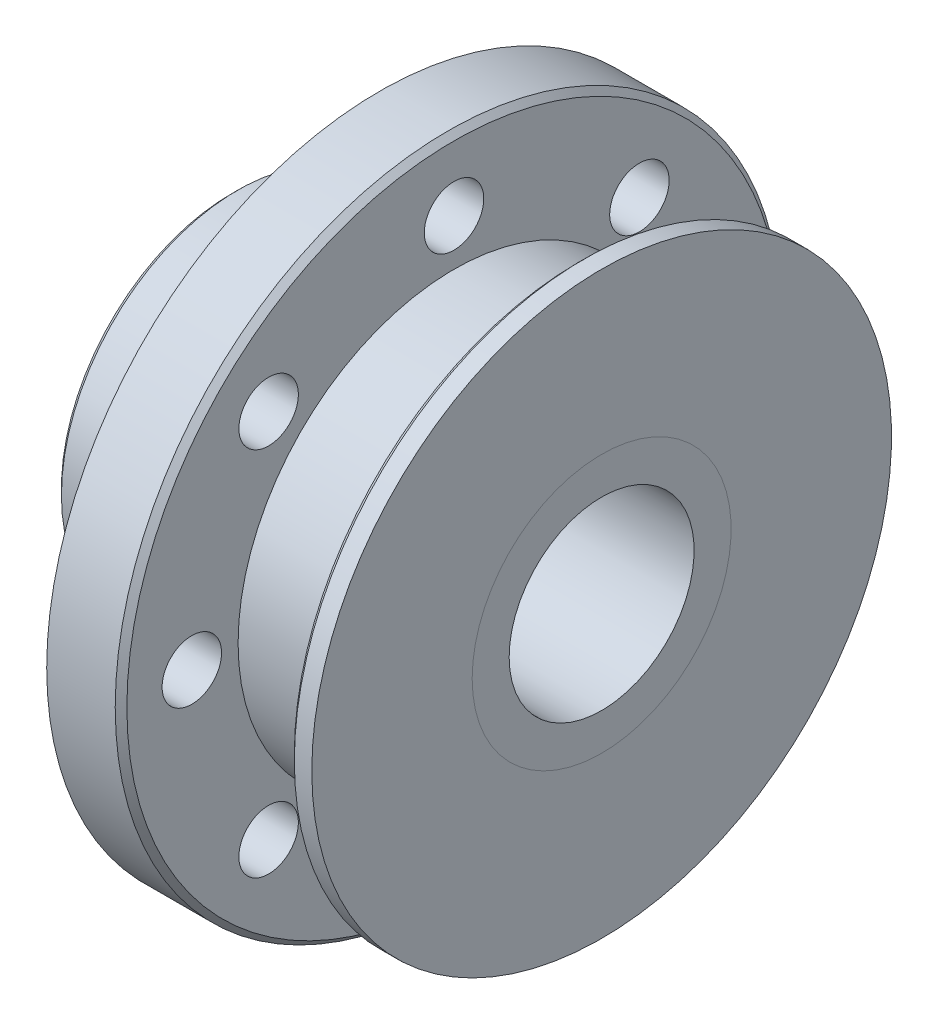
from build123d import *

# Parameters (mm, degrees)
F_1_4_20_TAPPED_HOLE1_D                     = 5.1054
F_1_4_20_TAPPED_HOLE1_DEPTH                 = 10.16
F_1_4_20_TAPPED_HOLE1_TIP                   = 1.533816902
SKETCH5_W                                   = 12.7
SKETCH5_H                                   = 3.175
CHAMFER1_SIZE                               = 0.5
TOL_SO_NEEDLE_ROLLER_SITS_FLUSH_OF_FACE_BY  = 0.1
TOL_SO_NEEDLE_ROLLER_SITS_FLUSH_OF_FACE2_BY = 0.100000054


with BuildPart() as part:
    # Sketch1 → Revolve1 (revolve)
    with BuildSketch(Plane.XY):
        Polygon((-12.7, 15.112500017), (0, 15.112500017), (0, 28.575), (6.37999994, 28.575), (6.37999994, 24.875000034), (6.37999994, 18.52951598), (17.04999994, 18.52951598), (17.04999994, 24.875000034), (19.05, 24.875000034), (19.05, 11.1125), (6.35, 11.1125), (6.35, 8.9375), (0, 8.9375), (0, 11.1125), (-12.7, 11.1125), align=None)
    revolve(axis=Axis((0, 0, 0), (1, 0, 0)))

    # 1/4-20 Tapped Hole1
    with Locations(Plane.ZY):
        with Locations((-15.909902577, -15.909902577), (-22.5, 0), (-15.909902577, 15.909902577), (0, 22.5), (15.909902577, 15.909902577), (22.5, 0), (15.909902577, -15.909902577), (0, -22.5)):
            Hole(F_1_4_20_TAPPED_HOLE1_D / 2, depth=F_1_4_20_TAPPED_HOLE1_DEPTH)
            with Locations((0, 0, -(F_1_4_20_TAPPED_HOLE1_DEPTH + F_1_4_20_TAPPED_HOLE1_TIP / 2))):  # 118° drill point
                Cone(0, F_1_4_20_TAPPED_HOLE1_D / 2, F_1_4_20_TAPPED_HOLE1_TIP, mode=Mode.SUBTRACT)

    # Chamfer1
    chamfer1_edges = [part.edges().sort_by_distance(p)[0] for p in [
        (17.04999994, -24.875000034, 0),
        (6.37999994, -28.575, 0),
        (-12.7, -15.112500017, 0),
    ]]
    chamfer(chamfer1_edges, length=CHAMFER1_SIZE)

    # Tol so Needle Roller sits flush of face: a face moved inward by 0.1
    extrude(part.faces().sort_by_distance((6.35, -5.55625, -8.89))[0], amount=TOL_SO_NEEDLE_ROLLER_SITS_FLUSH_OF_FACE_BY, dir=(-1, 0, 0), mode=Mode.SUBTRACT)

    # Tol so Needle Roller sits flush of face2: a face moved inward by 0.1
    extrude(part.faces().sort_by_distance((0, 5.55625, -8.89))[0], amount=TOL_SO_NEEDLE_ROLLER_SITS_FLUSH_OF_FACE2_BY, dir=(1, 0, 0), mode=Mode.SUBTRACT)


with BuildPart() as body_2:
    # Sketch5 → Revolve2 (revolve)
    with BuildSketch(Plane.XY):
        with Locations((12.7, 9.525)):
            Rectangle(SKETCH5_W, SKETCH5_H)
        with Locations((-6.35, 9.525)):
            Rectangle(SKETCH5_W, SKETCH5_H)
    revolve(axis=Axis((0, 0, 0), (1, 0, 0)))


solid = Compound([part.part, body_2.part])
